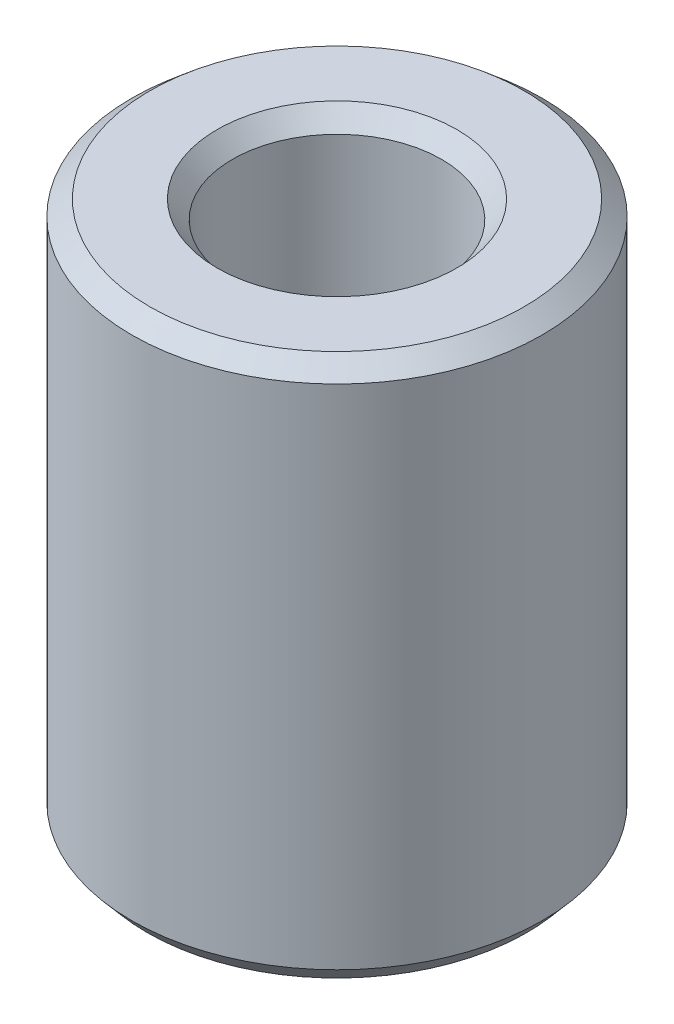
from build123d import *
from OCP.BRepFilletAPI import BRepFilletAPI_MakeChamfer

# Parameters (mm, degrees)
SKETCH1_R           = 12.5
BOSS_EXTRUDE1_DEPTH = 32.939681808
SKETCH2_R           = 6.369554759
CUT_EXTRUDE1_DEPTH  = 38.383454062
CHAMFER1_SIZE       = 0.937156252
CHAMFER1_SIZE2      = 1.099409322


with BuildPart() as part:
    # Sketch1 → Boss-Extrude1 (new body)
    with BuildSketch(Plane(origin=(0, 0, 0), x_dir=(1, 0, 0), z_dir=(0, 1, 0))):
        Circle(SKETCH1_R)
    extrude(amount=BOSS_EXTRUDE1_DEPTH)

    # Sketch2 → Cut-Extrude1 (cut, through all)
    with BuildSketch(Plane(origin=(0, 0, 0), x_dir=(1, 0, 0), z_dir=(0, 1, 0))):
        Circle(SKETCH2_R)
    extrude(amount=CUT_EXTRUDE1_DEPTH, mode=Mode.SUBTRACT)

    # Chamfer1: one chamfer whose edges measure the first distance from different faces: ONE call of the kernel's chamfer builder (chamfer() names one face for all edges)
    chamfer1_edges_1 = [part.edges().sort_by_distance(p)[0] for p in [
        (-6.369554759, 32.939681808, 0),
    ]]
    chamfer1_side_1 = [part.faces().sort_by_distance(p)[0] for p in [
        (-12.146446609, 32.939681808, 0),
    ]]
    chamfer1_edges_2 = [part.edges().sort_by_distance(p)[0] for p in [
        (-6.369554759, 0, 0),
    ]]
    chamfer1_side_2 = [part.faces().sort_by_distance(p)[0] for p in [
        (-6.369554759, 16.469840904, 0),
    ]]
    chamfer1_edges_3 = [part.edges().sort_by_distance(p)[0] for p in [
        (-12.5, 0, 0),
    ]]
    chamfer1_side_3 = [part.faces().sort_by_distance(p)[0] for p in [
        (-12.146446609, 0, 0),
    ]]
    chamfer1_edges_4 = [part.edges().sort_by_distance(p)[0] for p in [
        (-12.5, 32.939681808, 0),
    ]]
    chamfer1_side_4 = [part.faces().sort_by_distance(p)[0] for p in [
        (-12.5, 16.469840904, 0),
    ]]
    chamfer1 = BRepFilletAPI_MakeChamfer(part.part.solid().wrapped)
    for e in chamfer1_edges_1:
        chamfer1.Add(CHAMFER1_SIZE, CHAMFER1_SIZE2, e.wrapped, chamfer1_side_1[0].wrapped)  # the first distance lies on this face
    for e in chamfer1_edges_2:
        chamfer1.Add(CHAMFER1_SIZE, CHAMFER1_SIZE2, e.wrapped, chamfer1_side_2[0].wrapped)  # the first distance lies on this face
    for e in chamfer1_edges_3:
        chamfer1.Add(CHAMFER1_SIZE, CHAMFER1_SIZE2, e.wrapped, chamfer1_side_3[0].wrapped)  # the first distance lies on this face
    for e in chamfer1_edges_4:
        chamfer1.Add(CHAMFER1_SIZE, CHAMFER1_SIZE2, e.wrapped, chamfer1_side_4[0].wrapped)  # the first distance lies on this face
    add(Compound.cast(chamfer1.Shape()), mode=Mode.REPLACE)


solid = part.part
